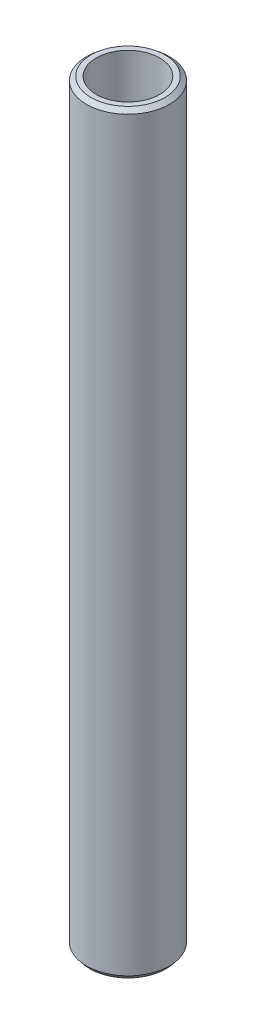
from build123d import *
from OCP.BRepFilletAPI import BRepFilletAPI_MakeChamfer

# Parameters (mm, degrees)
SKETCH1_R           = 30
BOSS_EXTRUDE1_DEPTH = 546.041719604
SKETCH2_R           = 22.961818407
CUT_EXTRUDE1_DEPTH  = 548.68746521
CHAMFER1_SIZE       = 2.679822963
CHAMFER1_SIZE2      = 3.238946388


with BuildPart() as part:
    # Sketch1 → Boss-Extrude1 (new body)
    with BuildSketch(Plane(origin=(0, 0, 0), x_dir=(1, 0, 0), z_dir=(0, 1, 0))):
        Circle(SKETCH1_R)
    extrude(amount=BOSS_EXTRUDE1_DEPTH)

    # Sketch2 → Cut-Extrude1 (cut, through all)
    with BuildSketch(Plane(origin=(0, 0, 0), x_dir=(1, 0, 0), z_dir=(0, 1, 0))):
        Circle(SKETCH2_R)
    extrude(amount=CUT_EXTRUDE1_DEPTH, mode=Mode.SUBTRACT)

    # Chamfer1: one chamfer whose edges measure the first distance from different faces: ONE call of the kernel's chamfer builder (chamfer() names one face for all edges)
    chamfer1_edges_1 = [part.edges().sort_by_distance(p)[0] for p in [
        (-30, 546.041719604, 0),
    ]]
    chamfer1_side_1 = [part.faces().sort_by_distance(p)[0] for p in [
        (-30, 273.020859802, 0),
    ]]
    chamfer1_edges_2 = [part.edges().sort_by_distance(p)[0] for p in [
        (-30, 0, 0),
    ]]
    chamfer1_side_2 = [part.faces().sort_by_distance(p)[0] for p in [
        (-29.151471863, 0, 0),
    ]]
    chamfer1 = BRepFilletAPI_MakeChamfer(part.part.solid().wrapped)
    for e in chamfer1_edges_1:
        chamfer1.Add(CHAMFER1_SIZE, CHAMFER1_SIZE2, e.wrapped, chamfer1_side_1[0].wrapped)  # the first distance lies on this face
    for e in chamfer1_edges_2:
        chamfer1.Add(CHAMFER1_SIZE, CHAMFER1_SIZE2, e.wrapped, chamfer1_side_2[0].wrapped)  # the first distance lies on this face
    add(Compound.cast(chamfer1.Shape()), mode=Mode.REPLACE)


solid = part.part
